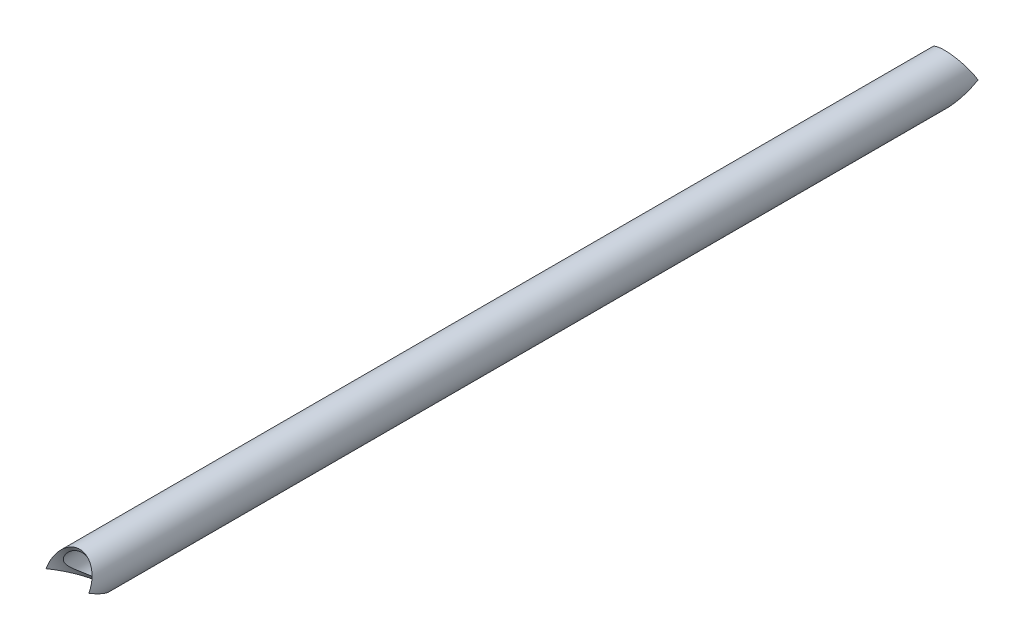
from build123d import *

# Parameters (mm, degrees)
EXTRUDE_START         = -221.492597215
EXTRUDE_1_OUTLINE_R   = 10.65
EXTRUDE_1_OUTLINE_R_2 = 8.65
EXTRUDE_1_DEPTH       = 221.492597215
EXTRUDE_START_2       = 86
EXTRUDE_1_2_DEPTH     = 30


with BuildPart() as part:
    # Бобышка-Вытянуть1: read off the stored shape, not the designer's step
    # Бобышка-Вытянуть1 outline → Бобышка-Вытянуть1 (new body)
    with BuildSketch(Plane.XY.offset(EXTRUDE_START)):
        with Locations((0, -6.075)):
            Circle(EXTRUDE_1_OUTLINE_R)
        with Locations((0, -6.075)):
            Circle(EXTRUDE_1_OUTLINE_R_2, mode=Mode.SUBTRACT)
    extrude(amount=EXTRUDE_1_DEPTH)

    # Extrude 1 2 outline → Extrude 1 2 (cut)
    with BuildSketch(Plane(origin=(0, 0, 0), x_dir=(1, 0, 0), z_dir=(0, 0.8660254037845095, -0.4999999999998773)).offset(EXTRUDE_START_2)):
        with BuildLine():
            ThreePointArc((-10.65, 194.855715851), (0, 184.205715851), (10.65, 194.855715851))
            Line((10.65, 194.855715851), (10.65, 202))
            Line((10.65, 202), (-10.65, 202))
            Line((-10.65, 202), (-10.65, 194.855715851))
        make_face()
    extrude(amount=EXTRUDE_1_2_DEPTH, mode=Mode.SUBTRACT)

    # Зеркальное отражение1: part across plane


with BuildPart() as part_1:
    add(part.part)
    add(part.part.mirror(Plane(origin=(0, -6.075, 0), x_dir=(1, 0, 0), z_dir=(0, 0, 1))))


solid = part_1.part
